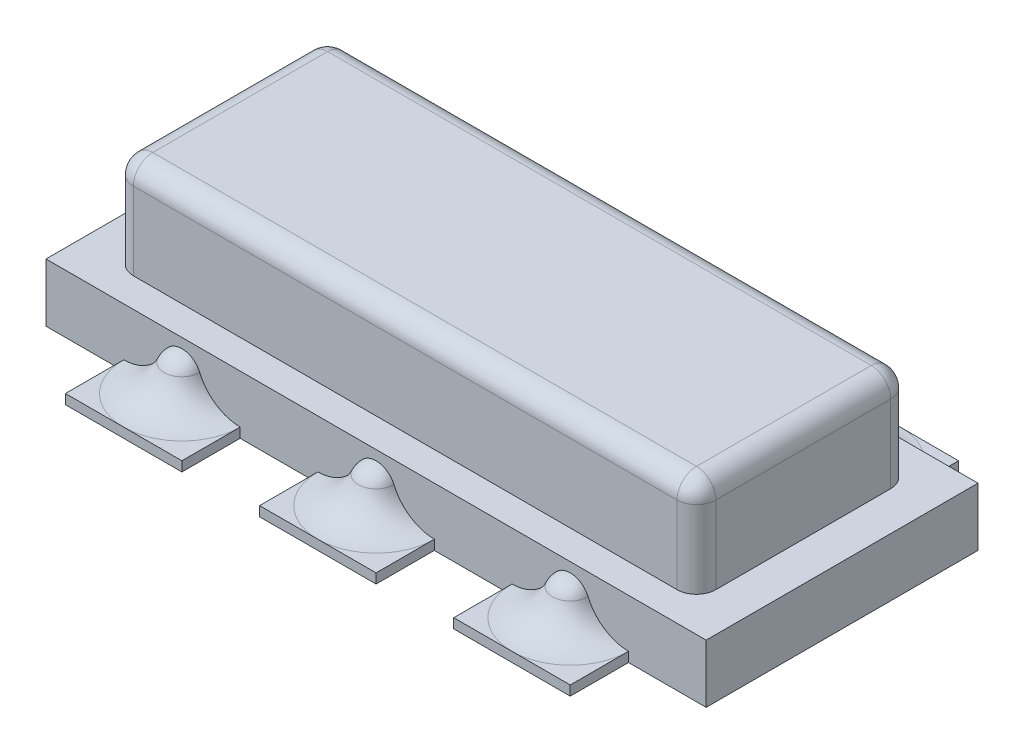
from build123d import *

# Parameters (mm, degrees)
SKETCH1_W            = 3.4
SKETCH1_H            = 1.4
BOSS_EXTRUDE1_DEPTH  = 0.3
BOSS_EXTRUDE2_DEPTH  = 0.5
FILLET1_R            = 0.1
SKETCH3_W            = 0.6
SKETCH3_H            = 2
BOSS_EXTRUDE3_DEPTH  = 0.05
LPATTERN1_COUNT      = 3
LPATTERN1_PITCH      = 1
LPATTERN1_COUNT_DIR2 = 2
LPATTERN1_PITCH_DIR2 = 1.4


with BuildPart() as part:
    # Sketch1 → Boss-Extrude1 (new body)
    with BuildSketch(Plane(origin=(0, 0, 0), x_dir=(1, 0, 0), z_dir=(0, 1, 0))):
        Rectangle(SKETCH1_W, SKETCH1_H)
    extrude(amount=BOSS_EXTRUDE1_DEPTH)

    # Sketch2 → Boss-Extrude2 (add)
    with BuildSketch(Plane(origin=(0, 0.3, 0), x_dir=(1, 0, 0), z_dir=(0, 1, 0))):
        with BuildLine():
            Line((-1.4, 0.55), (1.4, 0.55))
            ThreePointArc((1.4, 0.55), (1.470710678, 0.520710678), (1.5, 0.45))
            Line((1.5, 0.45), (1.5, -0.45))
            ThreePointArc((1.5, -0.45), (1.470710678, -0.520710678), (1.4, -0.55))
            Line((1.4, -0.55), (-1.4, -0.55))
            ThreePointArc((-1.4, -0.55), (-1.470710678, -0.520710678), (-1.5, -0.45))
            Line((-1.5, -0.45), (-1.5, 0.45))
            ThreePointArc((-1.5, 0.45), (-1.470710678, 0.520710678), (-1.4, 0.55))
        make_face()
    extrude(amount=BOSS_EXTRUDE2_DEPTH)

    # Fillet1
    fillet1_edges = [part.edges().sort_by_distance(p)[0] for p in [
        (-1.470710678, 0.8, 0.520710678),
        (-1.5, 0.8, 0),
        (-1.470710678, 0.8, -0.520710678),
        (0, 0.8, -0.55),
        (1.470710678, 0.8, -0.520710678),
        (1.5, 0.8, 0),
        (1.470710678, 0.8, 0.520710678),
        (0, 0.8, 0.55),
    ]]
    fillet(fillet1_edges, radius=FILLET1_R)

    # Sketch3 → Boss-Extrude3 (add)
    with BuildSketch(Plane(origin=(0, 0, 0), x_dir=(1, 0, 0), z_dir=(0, 1, 0))):
        with Locations((-1, 0)):
            Rectangle(SKETCH3_W, SKETCH3_H)
        Rectangle(SKETCH3_W, SKETCH3_H)
        with Locations((1, 0)):
            Rectangle(SKETCH3_W, SKETCH3_H)
    extrude(amount=BOSS_EXTRUDE3_DEPTH)

    # Sketch4 → Revolve2 (revolve)
    with BuildSketch(Plane(origin=(-1, 0, 0), x_dir=(0, 0, -1), z_dir=(1, 0, 0))):
        with BuildLine():
            Line((0.7, 0.25), (0.7, 0.05))
            Line((0.7, 0.05), (1, 0.05))
            ThreePointArc((1, 0.05), (0.87532212, 0.088886503), (0.791916764, 0.189386655))
            ThreePointArc((0.791916764, 0.189386655), (0.755051497, 0.233482529), (0.7, 0.25))
        make_face()
    revolve2 = revolve(axis=Axis((-1, 0.3, -0.7), (0, -1, 0)))

    # LPattern1: Revolve2 3 × 2
    with Locations(*[(i * LPATTERN1_PITCH, 0, j * LPATTERN1_PITCH_DIR2) for i in range(LPATTERN1_COUNT) for j in range(LPATTERN1_COUNT_DIR2) if (i, j) != (0, 0)]):
        add(revolve2)


solid = part.part
